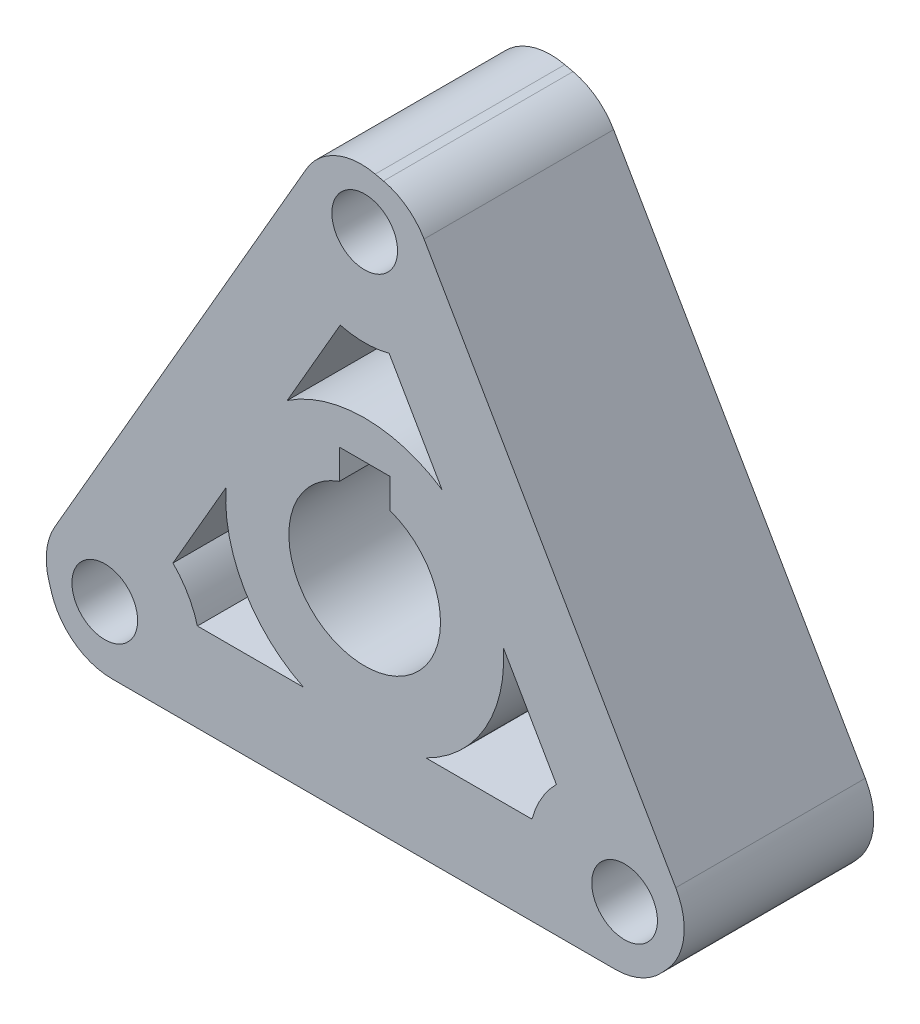
from build123d import *

# Parameters (mm, degrees)
SKETCH_1_R          = 2.6
EXTRUDE_1_DEPTH     = 15
CUT_EXTRUDE_1_REACH = 55.865
SKETCH_3_R          = 1.5
SKETCH_4_R          = 3.1
CUT_EXTRUDE_2_DEPTH = 3
CUT_EXTRUDE_3_DEPTH = 41.779116783


with BuildPart() as part:
    # ｽｹｯﾁ1 → ﾎﾞｽ - 押し出し1 (new body)
    with BuildSketch(Plane.XY):
        with BuildLine():
            ThreePointArc((0.836521252, 28.13264673), (-2.279272258, 27.84387272), (-4.613248654, 25.759618943))
            Line((-4.613248654, 25.759618943), (-24.528506183, -8.734618943))
            ThreePointArc((-24.528506183, -8.734618943), (-25.166534704, -10.671209204), (-24.978366464, -12.701493653))
            Line((-24.978366464, -12.701493653), (-24.781847369, -13.34187471))
            ThreePointArc((-24.781847369, -13.34187471), (-22.973864986, -15.895844038), (-20.00186007, -16.875))
            Line((-20.00186007, -16.875), (19.828654989, -16.875))
            ThreePointArc((19.828654989, -16.875), (21.824805612, -16.459253777), (23.488999402, -15.281153076))
            Line((23.488999402, -15.281153076), (23.945326118, -14.790772019))
            ThreePointArc((23.945326118, -14.790772019), (25.253137244, -11.948028682), (24.615108724, -8.884618943))
            Line((24.615108724, -8.884618943), (4.699851194, 25.609618943))
            ThreePointArc((4.699851194, 25.609618943), (3.341729092, 27.130462981), (1.489367062, 27.98264673))
            Line((1.489367062, 27.98264673), (0.836521252, 28.13264673))
        make_face()
        with Locations((-20.56810334, -11.875)):
            Circle(SKETCH_1_R, mode=Mode.SUBTRACT)
        with BuildLine():
            ThreePointArc((6, 0), (-3.464101615, -4.898979486), (-2, 5.656854249))
            Line((-2, 5.656854249), (-2, 8))
            Line((-2, 8), (2, 8))
            Line((2, 8), (2, 5.656854249))
            ThreePointArc((2, 5.656854249), (4.898979486, 3.464101615), (6, 0))
        make_face(mode=Mode.SUBTRACT)
        with Locations((20.56810334, -11.875)):
            Circle(SKETCH_1_R, mode=Mode.SUBTRACT)
        with Locations((0, 23.75)):
            Circle(SKETCH_1_R, mode=Mode.SUBTRACT)
    extrude(amount=EXTRUDE_1_DEPTH)

    # ｽｹｯﾁ3 → ｶｯﾄ - 押し出し1 (cut, up to next)
    with BuildSketch(Plane.XZ.offset(16.875), mode=Mode.PRIVATE) as cut_extrude_1_sk1:
        with Locations((0, 5)):
            Circle(SKETCH_3_R)
    cut_extrude_1_tool1 = extrude(cut_extrude_1_sk1.sketch, amount=-CUT_EXTRUDE_1_REACH, mode=Mode.PRIVATE) & part.part
    add(cut_extrude_1_tool1.solids().sort_by_distance((0, -16.875, 5))[0], mode=Mode.SUBTRACT)

    # ｽｹｯﾁ4 → ｶｯﾄ - 押し出し2 (cut)
    with BuildSketch(Plane.XZ.offset(16.875)):
        with Locations((0, 5)):
            Circle(SKETCH_4_R)
    extrude(amount=-CUT_EXTRUDE_2_DEPTH, mode=Mode.SUBTRACT)

    # ｽｹｯﾁ5 → ｶｯﾄ - 押し出し3 (cut, through all)
    with BuildSketch(Plane(origin=(0, 0, 0), x_dir=(-1, 0, 0), z_dir=(0, 0, -1))):
        with BuildLine():
            ThreePointArc((1.934009748, 16.400196853), (0, 16.15), (-1.934009748, 16.400196853))
            Line((-1.934009748, 16.400196853), (-6.128966865, 9.134317991))
            ThreePointArc((-6.128966865, 9.134317991), (0, 11), (6.128966865, 9.134317991))
            Line((6.128966865, 9.134317991), (1.934009748, 16.400196853))
        make_face()
        with BuildLine():
            ThreePointArc((-4.846067994, -9.875), (-9.526279442, -5.5), (-10.975034859, 0.740682009))
            Line((-10.975034859, 0.740682009), (-15.169991976, -6.525196853))
            ThreePointArc((-15.169991976, -6.525196853), (-13.986310271, -8.075), (-13.235982228, -9.875))
            Line((-13.235982228, -9.875), (-4.846067994, -9.875))
        make_face()
        with BuildLine():
            Line((15.169991976, -6.525196853), (10.975034859, 0.740682009))
            ThreePointArc((10.975034859, 0.740682009), (9.526279442, -5.5), (4.846067994, -9.875))
            Line((4.846067994, -9.875), (13.235982228, -9.875))
            ThreePointArc((13.235982228, -9.875), (13.986310271, -8.075), (15.169991976, -6.525196853))
        make_face()
    extrude(amount=-CUT_EXTRUDE_3_DEPTH, mode=Mode.SUBTRACT)


solid = part.part
